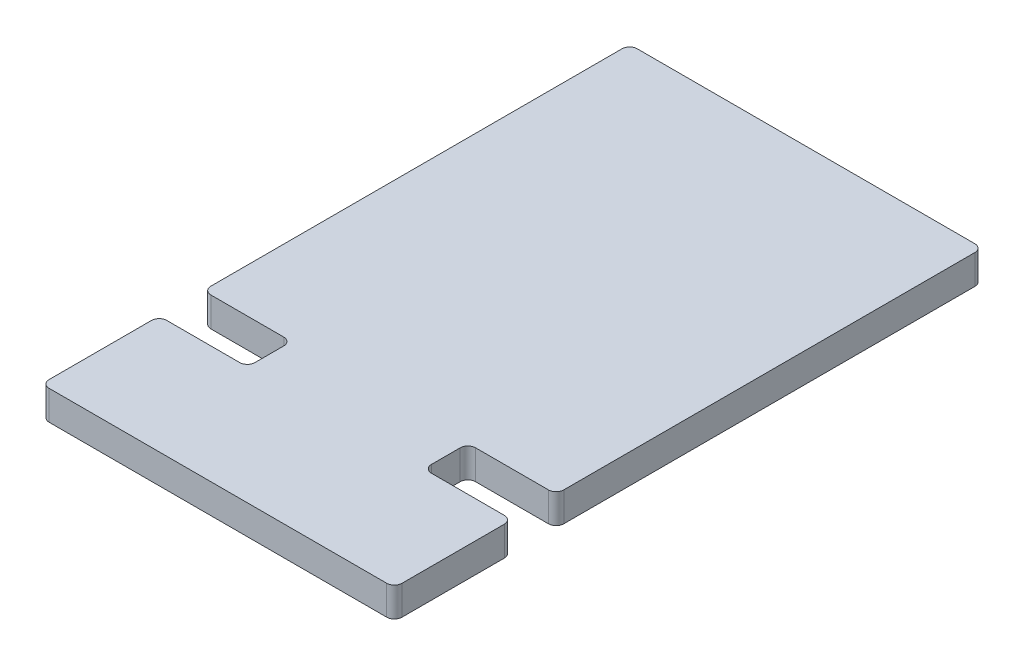
from build123d import *

# Parameters (mm, degrees)
SKETCH1_W            = 152.4
SKETCH1_H            = 254
BOSS_EXTRUDE1_DEPTH  = 12.7
SKETCH2_W            = 38.1
SKETCH2_H            = 19.05
CUT_EXTRUDE1_DEPTH   = 149.649688866
FILLET1_R            = 3.302
FILLET1_OF_MIRROR1_R = 3.302
FILLET2_R            = 3.302


with BuildPart() as part:
    # Sketch1 → Boss-Extrude1 (new body)
    with BuildSketch(Plane(origin=(0, 0, 0), x_dir=(1, 0, 0), z_dir=(0, 1, 0))):
        Rectangle(SKETCH1_W, SKETCH1_H)
    extrude(amount=BOSS_EXTRUDE1_DEPTH)

    # Sketch2 → Cut-Extrude1 (cut, through all)
    with BuildSketch(Plane(origin=(0, 12.7, 0), x_dir=(1, 0, 0), z_dir=(0, 1, 0))):
        with Locations((57.15, -66.675)):
            Rectangle(SKETCH2_W, SKETCH2_H)
    cut_extrude1 = extrude(amount=-CUT_EXTRUDE1_DEPTH, mode=Mode.SUBTRACT)

    # Fillet1
    fillet1_edges = [part.edges().sort_by_distance(p)[0] for p in [
        (38.1, 6.35, 76.2),
        (38.1, 6.35, 57.15),
    ]]
    fillet(fillet1_edges, radius=FILLET1_R)

    # Mirror1: Cut-Extrude1 across plane
    add(cut_extrude1.mirror(Plane(origin=(0, 0, 0), x_dir=(0, 0, 1), z_dir=(1, 0, 0))), mode=Mode.SUBTRACT)

    # Fillet1 of Mirror1
    fillet1_of_mirror1_edges = [part.edges().sort_by_distance(p)[0] for p in [
        (-38.1, 6.35, 76.2),
        (-38.1, 6.35, 57.15),
    ]]
    fillet(fillet1_of_mirror1_edges, radius=FILLET1_OF_MIRROR1_R)

    # Fillet2
    fillet2_edges = [part.edges().sort_by_distance(p)[0] for p in [
        (76.2, 6.35, 127),
        (76.2, 6.35, 76.2),
        (-76.2, 6.35, 127),
        (-76.2, 6.35, 76.2),
        (76.2, 6.35, 57.15),
        (-76.2, 6.35, 57.15),
        (76.2, 6.35, -127),
        (-76.2, 6.35, -127),
    ]]
    fillet(fillet2_edges, radius=FILLET2_R)


solid = part.part
